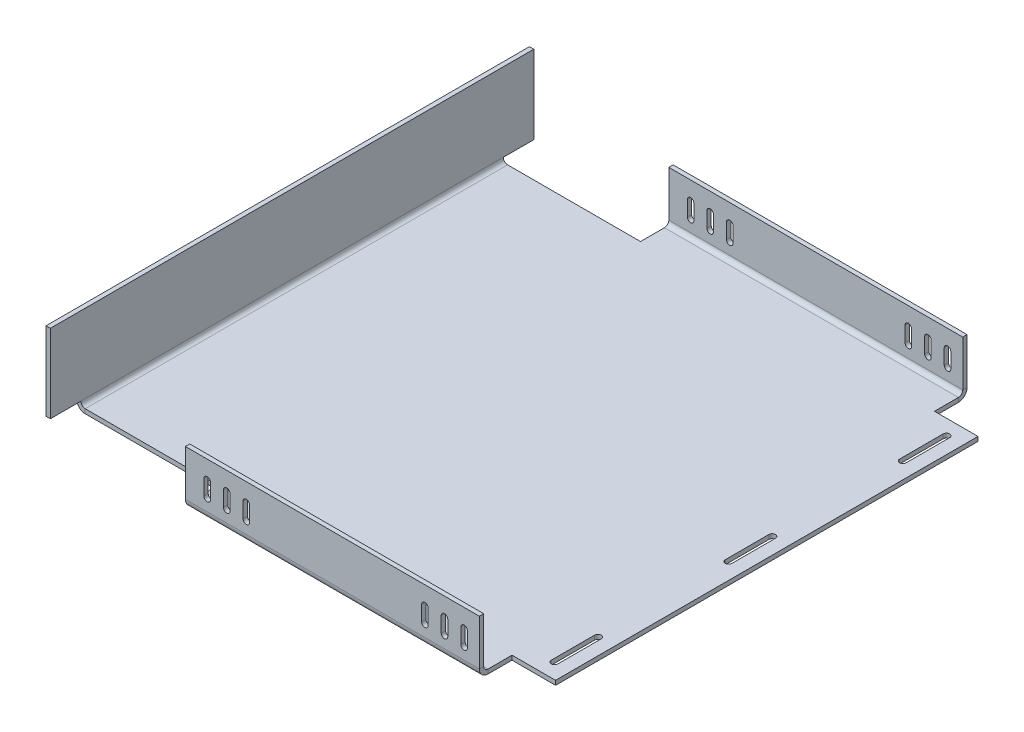
from build123d import *

# Parameters (mm, degrees)
SKETCH1_W                    = 200
SKETCH1_H                    = 224
BOSS_EXTRUDE1_DEPTH          = 1
SKETCH41_W                   = 65
SKETCH41_H                   = 15
CUT_EXTRUDE2_DEPTH           = 40
EDGE_FLANGE1_STRIP_W         = 12
EDGE_FLANGE1_STRIP_H         = 2
EDGE_FLANGE1_STRIP_CUT_DEPTH = 135
EDGE_FLANGE1_DEPTH           = 135
SKETCH53_W                   = 194
SKETCH53_H                   = 2
BOSS_EXTRUDE2_DEPTH          = 20
CUT_EXTRUDE3_DEPTH           = 20
EDGE_FLANGE3_STRIP_W         = 12
EDGE_FLANGE3_STRIP_H         = 2
EDGE_FLANGE3_STRIP_CUT_DEPTH = 194
EDGE_FLANGE3_DEPTH           = 194
SKETCH58_W                   = 2
SKETCH58_H                   = 36
BOSS_EXTRUDE3_DEPTH          = 14
CUT_EXTRUDE4_DEPTH           = 10


# Sheet-metal steps are written as plain solids
with BuildPart() as part:
    # Sketch1 → Boss-Extrude1 (new, symmetric)
    with BuildSketch(Plane(origin=(0, 0, 0), x_dir=(1, 0, 0), z_dir=(0, 1, 0))):
        Rectangle(SKETCH1_W, SKETCH1_H)
    extrude(amount=BOSS_EXTRUDE1_DEPTH, both=True)

    # Sketch41 → Cut-Extrude2 (cut)
    with BuildSketch(Plane(origin=(0, 1, 0), x_dir=(1, 0, 0), z_dir=(0, 1, 0))):
        with Locations((-67.5, -104.5)):
            Rectangle(SKETCH41_W, SKETCH41_H)
        with Locations((-67.5, 104.5)):
            Rectangle(SKETCH41_W, SKETCH41_H)
    extrude(amount=-CUT_EXTRUDE2_DEPTH, mode=Mode.SUBTRACT)

    # Edge-Flange1 strip (across the edge) → Edge-Flange1 strip cut (cut)
    with BuildSketch(Plane(origin=(-35, 1, 112), x_dir=(0, 0, -1), z_dir=(1, 0, 0))):
        with Locations((-2, -1)):
            Rectangle(EDGE_FLANGE1_STRIP_W, EDGE_FLANGE1_STRIP_H)
    edge_flange1_strip_cut = extrude(amount=EDGE_FLANGE1_STRIP_CUT_DEPTH, mode=Mode.SUBTRACT)

    # Edge-Flange1 section (across the edge) → Edge-Flange1 (add)
    with BuildSketch(Plane(origin=(-35, 1, 112), x_dir=(0, 0, -1), z_dir=(1, 0, 0))):
        with BuildLine():
            Line((0, 2), (0, 23))
            Line((0, 23), (2, 23))
            Line((2, 23), (2, 2))
            ThreePointArc((2, 2), (2.585786438, 0.585786438), (4, 0))
            Line((4, 0), (4, -2))
            ThreePointArc((4, -2), (1.171572875, -0.828427125), (0, 2))
        make_face()
    edge_flange1 = extrude(amount=EDGE_FLANGE1_DEPTH)

    # Mirror1: Edge-Flange1 strip cut, Edge-Flange1 across plane
    add(edge_flange1_strip_cut.mirror(Plane.XY), mode=Mode.SUBTRACT)
    add(edge_flange1.mirror(Plane.XY))

    # Sketch53 → Boss-Extrude2 (add)
    with BuildSketch(Plane(origin=(100, 0, 0), x_dir=(0, 0, -1), z_dir=(1, 0, 0))):
        Rectangle(SKETCH53_W, SKETCH53_H)
    extrude(amount=BOSS_EXTRUDE2_DEPTH)

    # Sketch54 → Cut-Extrude3 (cut)
    with BuildSketch(Plane(origin=(0, 0, 110), x_dir=(-1, 0, 0), z_dir=(0, 0, -1))):
        with BuildLine():
            Line((-94.5, 8.506539698), (-94.5, 15.506539698))
            ThreePointArc((-94.5, 15.506539698), (-93, 17.006539698), (-91.5, 15.506539698))
            Line((-91.5, 15.506539698), (-91.5, 8.506539698))
            ThreePointArc((-91.5, 8.506539698), (-93, 7.006539698), (-94.5, 8.506539698))
        make_face()
        with BuildLine():
            Line((-85.5, 8.506539698), (-85.5, 15.506539698))
            ThreePointArc((-85.5, 15.506539698), (-84, 17.006539698), (-82.5, 15.506539698))
            Line((-82.5, 15.506539698), (-82.5, 8.506539698))
            ThreePointArc((-82.5, 8.506539698), (-84, 7.006539698), (-85.5, 8.506539698))
        make_face()
        with BuildLine():
            Line((-76.5, 8.506539698), (-76.5, 15.506539698))
            ThreePointArc((-76.5, 15.506539698), (-75, 17.006539698), (-73.5, 15.506539698))
            Line((-73.5, 15.506539698), (-73.5, 8.506539698))
            ThreePointArc((-73.5, 8.506539698), (-75, 7.006539698), (-76.5, 8.506539698))
        make_face()
        with BuildLine():
            Line((14.5, 8.506539698), (14.5, 15.506539698))
            ThreePointArc((14.5, 15.506539698), (16, 17.006539698), (17.5, 15.506539698))
            Line((17.5, 15.506539698), (17.5, 8.506539698))
            ThreePointArc((17.5, 8.506539698), (16, 7.006539698), (14.5, 8.506539698))
        make_face()
        with BuildLine():
            Line((5.5, 8.506539698), (5.5, 15.506539698))
            ThreePointArc((5.5, 15.506539698), (7, 17.006539698), (8.5, 15.506539698))
            Line((8.5, 15.506539698), (8.5, 8.506539698))
            ThreePointArc((8.5, 8.506539698), (7, 7.006539698), (5.5, 8.506539698))
        make_face()
        with BuildLine():
            Line((23.5, 8.506539698), (23.5, 15.506539698))
            ThreePointArc((23.5, 15.506539698), (25, 17.006539698), (26.5, 15.506539698))
            Line((26.5, 15.506539698), (26.5, 8.506539698))
            ThreePointArc((26.5, 8.506539698), (25, 7.006539698), (23.5, 8.506539698))
        make_face()
    cut_extrude3 = extrude(amount=-CUT_EXTRUDE3_DEPTH, mode=Mode.SUBTRACT)

    # Edge-Flange3 strip (across the edge) → Edge-Flange3 strip cut (cut)
    with BuildSketch(Plane(origin=(-100, 1, -97), x_dir=(1, 0, 0), z_dir=(0, 0, 1))):
        with Locations((-2, -1)):
            Rectangle(EDGE_FLANGE3_STRIP_W, EDGE_FLANGE3_STRIP_H)
    extrude(amount=EDGE_FLANGE3_STRIP_CUT_DEPTH, mode=Mode.SUBTRACT)

    # Edge-Flange3 section (across the edge) → Edge-Flange3 (add)
    with BuildSketch(Plane(origin=(-100, 1, -97), x_dir=(1, 0, 0), z_dir=(0, 0, 1))):
        with BuildLine():
            Line((0, 2), (0, 38))
            Line((0, 38), (2, 38))
            Line((2, 38), (2, 2))
            ThreePointArc((2, 2), (2.585786438, 0.585786438), (4, 0))
            Line((4, 0), (4, -2))
            ThreePointArc((4, -2), (1.171572875, -0.828427125), (0, 2))
        make_face()
    extrude(amount=EDGE_FLANGE3_DEPTH)

    # Sketch58 → Boss-Extrude3 (add)
    with BuildSketch(Plane.XY.offset(97)):
        with Locations((-99, 21)):
            Rectangle(SKETCH58_W, SKETCH58_H)
    boss_extrude3 = extrude(amount=BOSS_EXTRUDE3_DEPTH)

    # Mirror2: Cut-Extrude3, Boss-Extrude3 across plane
    add(cut_extrude3.mirror(Plane.XY), mode=Mode.SUBTRACT)
    add(boss_extrude3.mirror(Plane.XY))

    # Sketch59 → Cut-Extrude4 (cut)
    with BuildSketch(Plane(origin=(0, 1, 0), x_dir=(1, 0, 0), z_dir=(0, 1, 0))):
        with BuildLine():
            Line((111, -90), (111, -70))
            ThreePointArc((111, -70), (112.5, -68.5), (114, -70))
            Line((114, -70), (114, -90))
            ThreePointArc((114, -90), (112.5, -91.5), (111, -90))
        make_face()
        with BuildLine():
            Line((111, -10), (111, 10))
            ThreePointArc((111, 10), (112.5, 11.5), (114, 10))
            Line((114, 10), (114, -10))
            ThreePointArc((114, -10), (112.5, -11.5), (111, -10))
        make_face()
        with BuildLine():
            Line((111, 90), (111, 70))
            ThreePointArc((111, 70), (112.5, 68.5), (114, 70))
            Line((114, 70), (114, 90))
            ThreePointArc((114, 90), (112.5, 91.5), (111, 90))
        make_face()
    extrude(amount=-CUT_EXTRUDE4_DEPTH, mode=Mode.SUBTRACT)


solid = part.part
